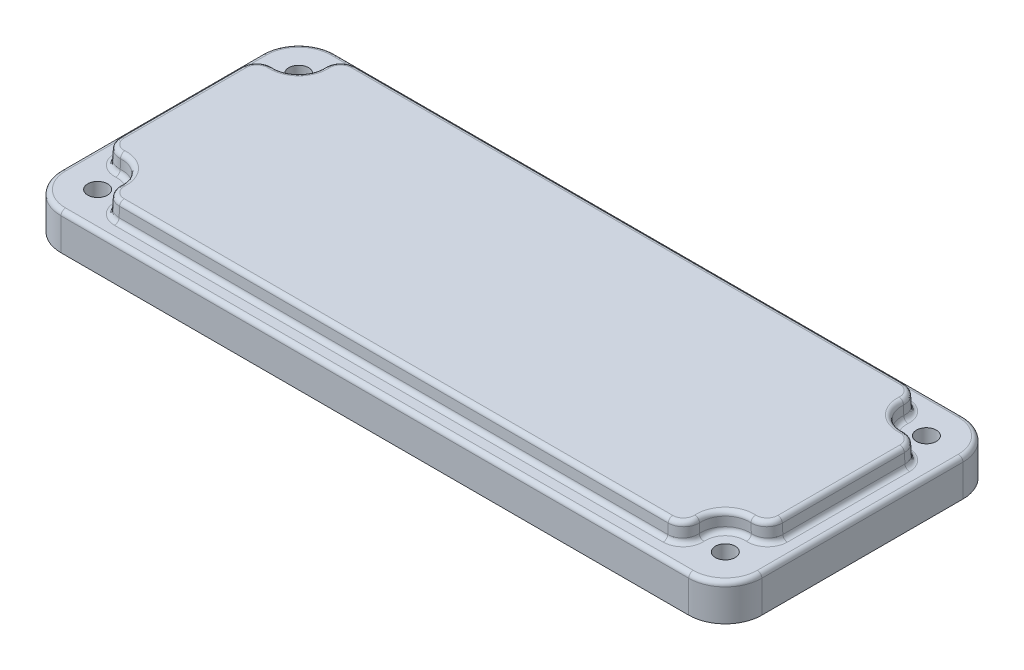
from build123d import *

# Parameters (mm, degrees)
BASE_EXTRUDE_DEPTH      = 6
BOSS_EXTRUDE1_DEPTH     = 3
BOSS_EXTRUDE1_TAPER     = 2.999999998
SKETCH3_R               = 4
CUT_EXTRUDE1_DEPTH      = 3
SKETCH4_R               = 1.625
CUT_EXTRUDE2_DEPTH      = 63.036279708
MIRROR2_COPY_1_SKETCH_R = 4
MIRROR2_COPY_1_DEPTH    = 3
MIRROR2_COPY_2_SKETCH_R = 1.625
MIRROR2_COPY_2_DEPTH    = 63.036279708
FILLET1_R               = 2.5
FILLET2_R               = 0.75
SKETCH5_W               = 91
SKETCH5_H               = 33
CUT_EXTRUDE3_DEPTH      = 6
CUT_EXTRUDE3_DRAFT      = -2.999999998
FILLET3_R               = 6
FILLET4_R               = 3


with BuildPart() as part:
    # Sketch1 → Base-Extrude (new body)
    with BuildSketch(Plane(origin=(0, 0, 0), x_dir=(1, 0, 0), z_dir=(0, 1, 0))):
        with BuildLine():
            Line((-51.5, 22.5), (51.5, 22.5))
            ThreePointArc((51.5, 22.5), (55.742640687, 20.742640687), (57.5, 16.5))
            Line((57.5, 16.5), (57.5, -16.5))
            ThreePointArc((57.5, -16.5), (55.742640687, -20.742640687), (51.5, -22.5))
            Line((51.5, -22.5), (-51.5, -22.5))
            ThreePointArc((-51.5, -22.5), (-55.742640687, -20.742640687), (-57.5, -16.5))
            Line((-57.5, -16.5), (-57.5, 16.5))
            ThreePointArc((-57.5, 16.5), (-55.742640687, 20.742640687), (-51.5, 22.5))
        make_face()
    extrude(amount=BASE_EXTRUDE_DEPTH)

    # Sketch2 → Boss-Extrude1 (add)
    with BuildSketch(Plane(origin=(0, 6, 0), x_dir=(-1, 0, 0), z_dir=(0, 1, 0))):
        with BuildLine():
            Line((51.5, 19.5), (-51.5, 19.5))
            ThreePointArc((-51.5, 19.5), (-53.621320344, 18.621320344), (-54.5, 16.5))
            Line((-54.5, 16.5), (-54.5, -16.5))
            ThreePointArc((-54.5, -16.5), (-53.621320344, -18.621320344), (-51.5, -19.5))
            Line((-51.5, -19.5), (51.5, -19.5))
            ThreePointArc((51.5, -19.5), (53.621320344, -18.621320344), (54.5, -16.5))
            Line((54.5, -16.5), (54.5, 16.5))
            ThreePointArc((54.5, 16.5), (53.621320344, 18.621320344), (51.5, 19.5))
        make_face()
    extrude(amount=BOSS_EXTRUDE1_DEPTH, taper=BOSS_EXTRUDE1_TAPER)

    # Sketch3 → Cut-Extrude1 (cut)
    with BuildSketch(Plane(origin=(0, 9, 0), x_dir=(-1, 0, 0), z_dir=(0, 1, 0))):
        with Locations((-51.5, 16.5)):
            Circle(SKETCH3_R)
    cut_extrude1 = extrude(amount=-CUT_EXTRUDE1_DEPTH, mode=Mode.SUBTRACT)

    # Sketch4 → Cut-Extrude2 (cut, through all)
    with BuildSketch(Plane(origin=(0, 6, 0), x_dir=(-1, 0, 0), z_dir=(0, 1, 0))):
        with Locations(Location((-51.5, 16.5, 0), (0, 0, 90))):
            Circle(SKETCH4_R)
    cut_extrude2 = extrude(amount=-CUT_EXTRUDE2_DEPTH, mode=Mode.SUBTRACT)

    # Mirror1: Cut-Extrude1, Cut-Extrude2 across plane
    add(cut_extrude1.mirror(Plane.XY), mode=Mode.SUBTRACT)
    add(cut_extrude2.mirror(Plane.XY), mode=Mode.SUBTRACT)

    # Mirror2: Cut-Extrude1, Cut-Extrude2 across plane
    add(cut_extrude1.mirror(Plane(origin=(0, 0, 0), x_dir=(0, 0, 1), z_dir=(1, 0, 0))), mode=Mode.SUBTRACT)
    add(cut_extrude2.mirror(Plane(origin=(0, 0, 0), x_dir=(0, 0, 1), z_dir=(1, 0, 0))), mode=Mode.SUBTRACT)

    # Mirror2 copy 1 sketch → Mirror2 copy 1 (cut)
    with BuildSketch(Plane(origin=(0, 9, 0), x_dir=(1, 0, 0), z_dir=(0, 1, 0))):
        with Locations((-51.5, 16.5)):
            Circle(MIRROR2_COPY_1_SKETCH_R)
    extrude(amount=-MIRROR2_COPY_1_DEPTH, mode=Mode.SUBTRACT)

    # Mirror2 copy 2 sketch → Mirror2 copy 2 (cut, through all)
    with BuildSketch(Plane(origin=(0, 6, 0), x_dir=(1, 0, 0), z_dir=(0, 1, 0))):
        with Locations(Location((-51.5, 16.5, 0), (0, 0, 90))):
            Circle(MIRROR2_COPY_2_SKETCH_R)
    extrude(amount=-MIRROR2_COPY_2_DEPTH, mode=Mode.SUBTRACT)

    # Fillet1
    fillet1_edges = [part.edges().sort_by_distance(p)[0] for p in [
        (54.421395426, 7.499864617, 13.767702658),
        (48.767702658, 7.499864617, 19.421395426),
        (54.421395426, 7.499864617, -13.767702658),
        (48.767702658, 7.499864617, -19.421395426),
        (-54.421395426, 7.499864617, -13.767702658),
        (-48.767702658, 7.499864617, -19.421395426),
        (-48.767702658, 7.499864617, 19.421395426),
        (-54.421395426, 7.499864617, 13.767702658),
    ]]
    fillet(fillet1_edges, radius=FILLET1_R)

    # Fillet2
    fillet2_edges = [part.edges().sort_by_distance(p)[0] for p in [
        (55.742640687, 6, 20.742640687),
        (1.49e-07, 6, 19.5),
        (-3e-09, 9, 19.342776662),
        (-54.342776662, 9, -3e-09),
        (-48.671572875, 9, 13.671572875),
        (48.671572875, 9, 13.671572875),
        (54.342776662, 9, 3e-09),
        (48.671572875, 9, -13.671572875),
        (3e-09, 9, -19.342776662),
        (-48.671572875, 9, -13.671572875),
        (-46.824439523, 9, 18.561496685),
        (-53.561496687, 9, 11.82443952),
        (-53.561496685, 9, -11.824439523),
        (-46.82443952, 9, -18.561496687),
        (46.824439523, 9, -18.561496685),
        (53.561496688, 9, -11.824439521),
        (53.561496685, 9, 11.824439523),
        (46.824439521, 9, 18.561496688),
        (48.67157288, 6, 13.67157287),
        (54.5, 6, -1.49e-07),
        (48.67157287, 6, -13.67157288),
        (-1.49e-07, 6, -19.5),
        (-48.67157288, 6, -13.67157287),
        (-54.5, 6, 1.49e-07),
        (-48.67157287, 6, 13.67157288),
        (46.855716455, 6, 18.696446424),
        (57.5, 6, 0),
        (53.696446497, 6, 11.855716323),
        (53.696446424, 6, -11.855716455),
        (46.855716323, 6, -18.696446496),
        (-46.855716455, 6, -18.696446424),
        (-53.696446496, 6, -11.855716323),
        (-53.696446424, 6, 11.855716455),
        (-46.855716323, 6, 18.696446497),
        (55.742640687, 6, -20.742640687),
        (0, 6, -22.5),
        (-55.742640687, 6, -20.742640687),
        (-57.5, 6, 0),
        (-55.742640687, 6, 20.742640687),
        (0, 6, 22.5),
    ]]
    fillet(fillet2_edges, radius=FILLET2_R)


with BuildPart() as cut_extrude3_tool:
    # Sketch5 → Cut-Extrude3 (with draft: the straight prism first)
    with BuildSketch(Plane.XZ):
        Rectangle(SKETCH5_W, SKETCH5_H)
    extrude(amount=-CUT_EXTRUDE3_DEPTH)
    # Cut-Extrude3: the draft: its side faces are tilted about the plane it starts from
    cut_extrude3_sides = [cut_extrude3_tool.faces().sort_by_distance(p)[0] for p in [
        (-45.5, 3, 0),
        (0, 3, -16.5),
        (45.5, 3, 0),
        (0, 3, 16.5),
    ]]
    draft(cut_extrude3_sides, Plane.XZ, CUT_EXTRUDE3_DRAFT)


with BuildPart() as part_1:
    add(part.part)

    # Cut-Extrude3: cut by cut_extrude3_tool
    add(cut_extrude3_tool.part, mode=Mode.SUBTRACT)

    # Fillet3
    fillet3_edges = [part_1.edges().sort_by_distance(p)[0] for p in [
        (-45.342776662, 3, -16.342776662),
        (-45.342776662, 3, 16.342776662),
        (45.342776662, 3, 16.342776662),
        (45.342776662, 3, -16.342776662),
    ]]
    fillet(fillet3_edges, radius=FILLET3_R)

    # Fillet4
    fillet4_edges = [part_1.edges().sort_by_distance(p)[0] for p in [
        (-45.185553325, 6, 0),
        (0, 6, 16.185553325),
        (0, 6, -16.185553325),
        (45.185553325, 6, 0),
        (-43.431596709, 6, -14.431596709),
        (43.431596709, 6, 14.431596709),
        (43.431596709, 6, -14.431596709),
        (-43.431596709, 6, 14.431596709),
    ]]
    fillet(fillet4_edges, radius=FILLET4_R)


solid = part_1.part
